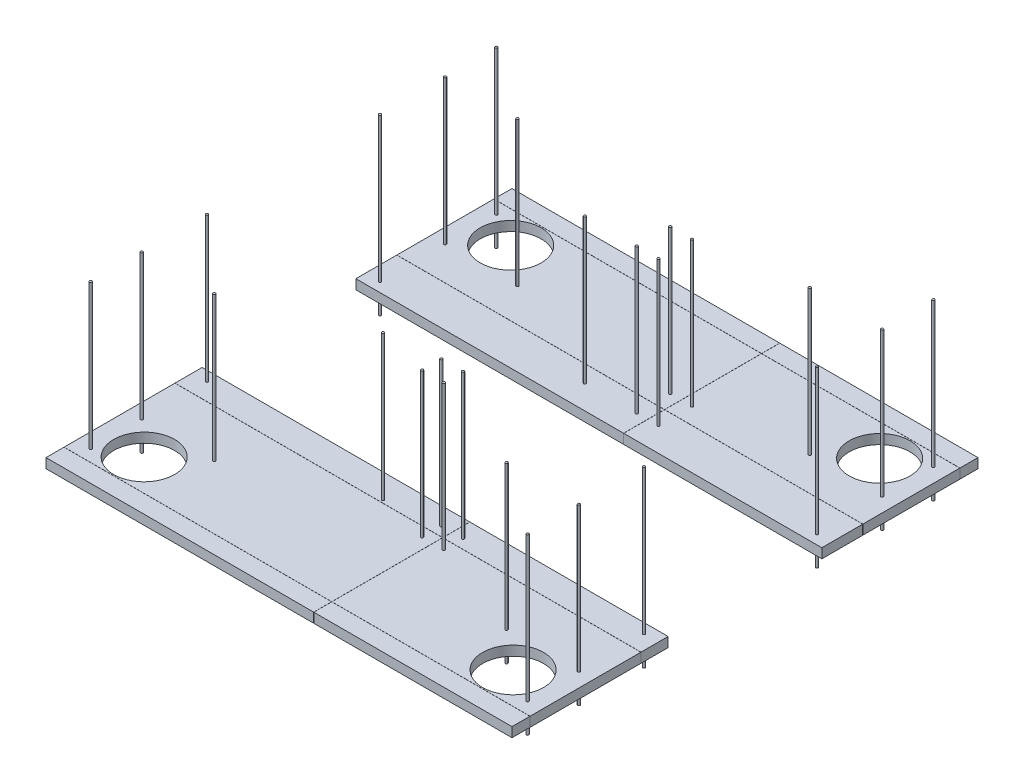
from build123d import *

# Parameters (mm, degrees)
SKETCH1_W                          = 4908.55
SKETCH1_H                          = 4908.55
BOSS_EXTRUDE1_DEPTH                = 101.6
SKETCH2_W                          = 4908.55
SKETCH2_H                          = 1619.25
CUT_EXTRUDE1_DEPTH                 = 3473.355700566
SKETCH4_W                          = 4908.55
SKETCH4_H                          = 1.27
CUT_EXTRUDE_THIN1_DEPTH            = 3473.355700566
CUT_EXTRUDE_THIN2_DEPTH            = 3473.355700566
CUT_EXTRUDE_THIN2_DEPTH_BACK       = 3473.355700566
SKETCH5_W                          = 1.27
SKETCH5_H                          = 4908.55
SKETCH6_R                          = 320.675
DUCT_HOLES_DEPTH                   = 3473.355700566
UNISTRUT_STUD_LAYOUT_DEPTH         = 1524
UNISTRUT_STUD_LAYOUT_DEPTH_BACK    = 304.8
SKETCH7_R                          = 12.7
UNISTRUT_STUD_LAYOUT_2_DEPTH       = 1524
UNISTRUT_STUD_LAYOUT_2_DEPTH_BACK  = 304.8
UNISTRUT_STUD_LAYOUT_3_DEPTH       = 1524
UNISTRUT_STUD_LAYOUT_3_DEPTH_BACK  = 304.8
UNISTRUT_STUD_LAYOUT_4_DEPTH       = 1524
UNISTRUT_STUD_LAYOUT_4_DEPTH_BACK  = 304.8
UNISTRUT_STUD_LAYOUT_5_DEPTH       = 1524
UNISTRUT_STUD_LAYOUT_5_DEPTH_BACK  = 304.8
UNISTRUT_STUD_LAYOUT_6_DEPTH       = 1524
UNISTRUT_STUD_LAYOUT_6_DEPTH_BACK  = 304.8
UNISTRUT_STUD_LAYOUT_7_DEPTH       = 1524
UNISTRUT_STUD_LAYOUT_7_DEPTH_BACK  = 304.8
UNISTRUT_STUD_LAYOUT_8_DEPTH       = 1524
UNISTRUT_STUD_LAYOUT_8_DEPTH_BACK  = 304.8
UNISTRUT_STUD_LAYOUT_9_DEPTH       = 1524
UNISTRUT_STUD_LAYOUT_9_DEPTH_BACK  = 304.8
UNISTRUT_STUD_LAYOUT_10_DEPTH      = 1524
UNISTRUT_STUD_LAYOUT_10_DEPTH_BACK = 304.8
UNISTRUT_STUD_LAYOUT_11_DEPTH      = 1524
UNISTRUT_STUD_LAYOUT_11_DEPTH_BACK = 304.8
UNISTRUT_STUD_LAYOUT_12_DEPTH      = 1524
UNISTRUT_STUD_LAYOUT_12_DEPTH_BACK = 304.8
UNISTRUT_STUD_LAYOUT_13_DEPTH      = 1524
UNISTRUT_STUD_LAYOUT_13_DEPTH_BACK = 304.8
UNISTRUT_STUD_LAYOUT_14_DEPTH      = 1524
UNISTRUT_STUD_LAYOUT_14_DEPTH_BACK = 304.8
UNISTRUT_STUD_LAYOUT_15_DEPTH      = 1524
UNISTRUT_STUD_LAYOUT_15_DEPTH_BACK = 304.8
UNISTRUT_STUD_LAYOUT_16_DEPTH      = 1524
UNISTRUT_STUD_LAYOUT_16_DEPTH_BACK = 304.8
UNISTRUT_STUD_LAYOUT_17_DEPTH      = 1524
UNISTRUT_STUD_LAYOUT_17_DEPTH_BACK = 304.8


with BuildPart() as part:
    # Sketch1 → Boss-Extrude1 (new body)
    with BuildSketch(Plane(origin=(0, 0, 0), x_dir=(1, 0, 0), z_dir=(0, 1, 0))):
        Rectangle(SKETCH1_W, SKETCH1_H)
    extrude(amount=BOSS_EXTRUDE1_DEPTH)

    # Sketch2 → Cut-Extrude1 (cut, through all)
    with BuildSketch(Plane(origin=(0, 101.6, 0), x_dir=(1, 0, 0), z_dir=(0, 1, 0))):
        Rectangle(SKETCH2_W, SKETCH2_H)
    extrude(amount=-CUT_EXTRUDE1_DEPTH, mode=Mode.SUBTRACT)


with BuildPart() as cut_extrude1_piece_1:
    # of the separate pieces the step leaves, piece 1, a body of its own (cut_extrude1_pieces)
    add(part.part.solids().sort_by_distance((-2454.275, 0, -2454.275))[0])


with BuildPart() as cut_extrude1_piece_2:
    # of the separate pieces the step leaves, piece 2, a body of its own (cut_extrude1_pieces)
    add(part.part.solids().sort_by_distance((-2454.275, 0, 2454.275))[0])


with BuildPart() as cut_extrude_thin1_tool:
    # Sketch4 → Cut-Extrude-Thin1 (new, through all)
    with BuildSketch(Plane(origin=(0, 101.6, 0), x_dir=(1, 0, 0), z_dir=(0, 1, 0))):
        with Locations((0, -2264.41)):
            Rectangle(SKETCH4_W, SKETCH4_H)
        with Locations((0, -1096.01)):
            Rectangle(SKETCH4_W, SKETCH4_H)
        with Locations((0, 2263.14)):
            Rectangle(SKETCH4_W, SKETCH4_H)
        with Locations((0, 1240.79)):
            Rectangle(SKETCH4_W, SKETCH4_H)
    extrude(amount=-CUT_EXTRUDE_THIN1_DEPTH)


with BuildPart() as cut_extrude1_piece_1_1:
    add(cut_extrude1_piece_1.part)

    # Cut-Extrude-Thin1: cut by cut_extrude_thin1_tool
    add(cut_extrude_thin1_tool.part, mode=Mode.SUBTRACT)


with BuildPart() as cut_extrude1_piece_2_1:
    add(cut_extrude1_piece_2.part)

    # Cut-Extrude-Thin1: cut by cut_extrude_thin1_tool
    add(cut_extrude_thin1_tool.part, mode=Mode.SUBTRACT)


with BuildPart() as cut_extrude_thin1_piece_1:
    # of the separate pieces the step leaves, piece 1, a body of its own (cut_extrude_thin1_pieces)
    add(cut_extrude1_piece_1_1.part.solids().sort_by_distance((-2454.275, 0, -1241.425))[0])


with BuildPart() as cut_extrude_thin1_piece_2:
    # of the separate pieces the step leaves, piece 2, a body of its own (cut_extrude_thin1_pieces)
    add(cut_extrude1_piece_1_1.part.solids().sort_by_distance((-2454.275, 0, -809.625))[0])


with BuildPart() as cut_extrude_thin1_piece_3:
    # of the separate pieces the step leaves, piece 3, a body of its own (cut_extrude_thin1_pieces)
    add(cut_extrude1_piece_1_1.part.solids().sort_by_distance((-2454.275, 0, -2454.275))[0])


with BuildPart() as cut_extrude_thin1_piece_1_of_cut_extrude:
    # of the separate pieces the step leaves, piece 1, a body of its own (cut_extrude_thin1_pieces_of_cut_extrude1)
    add(cut_extrude1_piece_2_1.part.solids().sort_by_distance((-2454.275, 0, 2263.775))[0])


with BuildPart() as cut_extrude_thin1_piece_2_of_cut_extrude:
    # of the separate pieces the step leaves, piece 2, a body of its own (cut_extrude_thin1_pieces_of_cut_extrude1)
    add(cut_extrude1_piece_2_1.part.solids().sort_by_distance((-2454.275, 0, 1095.375))[0])


with BuildPart() as cut_extrude_thin1_piece_3_of_cut_extrude:
    # of the separate pieces the step leaves, piece 3, a body of its own (cut_extrude_thin1_pieces_of_cut_extrude1)
    add(cut_extrude1_piece_2_1.part.solids().sort_by_distance((-2454.275, 0, 2454.275))[0])


with BuildPart() as cut_extrude_thin2_tool:
    # Sketch5 → Cut-Extrude-Thin2 (new, two sides: drawn at the far end of the back side and taken through both)
    with BuildSketch(Plane(origin=(0, 101.6, 0), x_dir=(1, 0, 0), z_dir=(0, 1, 0)).offset(-CUT_EXTRUDE_THIN2_DEPTH_BACK)):
        with Locations((365.76, 0)):
            Rectangle(SKETCH5_W, SKETCH5_H)
    extrude(amount=CUT_EXTRUDE_THIN2_DEPTH + CUT_EXTRUDE_THIN2_DEPTH_BACK)


with BuildPart() as cut_extrude_thin1_piece_1_1:
    add(cut_extrude_thin1_piece_1.part)

    # Cut-Extrude-Thin2: cut by cut_extrude_thin2_tool
    add(cut_extrude_thin2_tool.part, mode=Mode.SUBTRACT)


with BuildPart() as cut_extrude_thin1_piece_2_1:
    add(cut_extrude_thin1_piece_2.part)

    # Cut-Extrude-Thin2: cut by cut_extrude_thin2_tool
    add(cut_extrude_thin2_tool.part, mode=Mode.SUBTRACT)


with BuildPart() as cut_extrude_thin1_piece_3_1:
    add(cut_extrude_thin1_piece_3.part)

    # Cut-Extrude-Thin2: cut by cut_extrude_thin2_tool
    add(cut_extrude_thin2_tool.part, mode=Mode.SUBTRACT)


with BuildPart() as cut_extrude_thin1_piece_1_of_cut_extrude_1:
    add(cut_extrude_thin1_piece_1_of_cut_extrude.part)

    # Cut-Extrude-Thin2: cut by cut_extrude_thin2_tool
    add(cut_extrude_thin2_tool.part, mode=Mode.SUBTRACT)


with BuildPart() as cut_extrude_thin1_piece_2_of_cut_extrude_1:
    add(cut_extrude_thin1_piece_2_of_cut_extrude.part)

    # Cut-Extrude-Thin2: cut by cut_extrude_thin2_tool
    add(cut_extrude_thin2_tool.part, mode=Mode.SUBTRACT)


with BuildPart() as cut_extrude_thin1_piece_3_of_cut_extrude_1:
    add(cut_extrude_thin1_piece_3_of_cut_extrude.part)

    # Cut-Extrude-Thin2: cut by cut_extrude_thin2_tool
    add(cut_extrude_thin2_tool.part, mode=Mode.SUBTRACT)


with BuildPart() as cut_extrude_thin2_piece_1:
    # of the separate pieces the step leaves, piece 1, a body of its own (cut_extrude_thin2_pieces)
    add(cut_extrude_thin1_piece_1_1.part.solids().sort_by_distance((-2454.275, 0, -1241.425))[0])


with BuildPart() as cut_extrude_thin2_piece_2:
    # of the separate pieces the step leaves, piece 2, a body of its own (cut_extrude_thin2_pieces)
    add(cut_extrude_thin1_piece_1_1.part.solids().sort_by_distance((2454.275, 0, -2262.505))[0])


with BuildPart() as cut_extrude_thin2_piece_1_of_cut_extrude:
    # of the separate pieces the step leaves, piece 1, a body of its own (cut_extrude_thin2_pieces_of_cut_extrude)
    add(cut_extrude_thin1_piece_2_1.part.solids().sort_by_distance((-2454.275, 0, -809.625))[0])


with BuildPart() as cut_extrude_thin2_piece_2_of_cut_extrude:
    # of the separate pieces the step leaves, piece 2, a body of its own (cut_extrude_thin2_pieces_of_cut_extrude)
    add(cut_extrude_thin1_piece_2_1.part.solids().sort_by_distance((2454.275, 0, -1240.155))[0])


with BuildPart() as cut_extrude_thin2_piece_1_of_cut_ext_2:
    # of the separate pieces the step leaves, piece 1, a body of its own (cut_extrude_thin2_pieces_of_cut_extr_2)
    add(cut_extrude_thin1_piece_3_1.part.solids().sort_by_distance((-2454.275, 0, -2454.275))[0])


with BuildPart() as cut_extrude_thin2_piece_2_of_cut_ext_2:
    # of the separate pieces the step leaves, piece 2, a body of its own (cut_extrude_thin2_pieces_of_cut_extr_2)
    add(cut_extrude_thin1_piece_3_1.part.solids().sort_by_distance((366.395, 0, -2454.275))[0])


with BuildPart() as cut_extrude_thin2_piece_1_of_cut_ext_3:
    # of the separate pieces the step leaves, piece 1, a body of its own (cut_extrude_thin2_pieces_of_cut_extr_3)
    add(cut_extrude_thin1_piece_1_of_cut_extrude_1.part.solids().sort_by_distance((-2454.275, 0, 2263.775))[0])


with BuildPart() as cut_extrude_thin2_piece_2_of_cut_ext_3:
    # of the separate pieces the step leaves, piece 2, a body of its own (cut_extrude_thin2_pieces_of_cut_extr_3)
    add(cut_extrude_thin1_piece_1_of_cut_extrude_1.part.solids().sort_by_distance((2454.275, 0, 1096.645))[0])


with BuildPart() as cut_extrude_thin2_piece_1_of_cut_ext_4:
    # of the separate pieces the step leaves, piece 1, a body of its own (cut_extrude_thin2_pieces_of_cut_extr_4)
    add(cut_extrude_thin1_piece_2_of_cut_extrude_1.part.solids().sort_by_distance((-2454.275, 0, 1095.375))[0])


with BuildPart() as cut_extrude_thin2_piece_2_of_cut_ext_4:
    # of the separate pieces the step leaves, piece 2, a body of its own (cut_extrude_thin2_pieces_of_cut_extr_4)
    add(cut_extrude_thin1_piece_2_of_cut_extrude_1.part.solids().sort_by_distance((2454.275, 0, 809.625))[0])


with BuildPart() as cut_extrude_thin2_piece_1_of_cut_ext_5:
    # of the separate pieces the step leaves, piece 1, a body of its own (cut_extrude_thin2_pieces_of_cut_extr_5)
    add(cut_extrude_thin1_piece_3_of_cut_extrude_1.part.solids().sort_by_distance((-2454.275, 0, 2454.275))[0])


with BuildPart() as cut_extrude_thin2_piece_2_of_cut_ext_5:
    # of the separate pieces the step leaves, piece 2, a body of its own (cut_extrude_thin2_pieces_of_cut_extr_5)
    add(cut_extrude_thin1_piece_3_of_cut_extrude_1.part.solids().sort_by_distance((2454.275, 0, 2265.045))[0])


with BuildPart() as duct_holes_tool:
    # Sketch6 → DUCT HOLES (new, through all)
    with BuildSketch(Plane(origin=(0, 101.6, 0), x_dir=(1, 0, 0), z_dir=(0, 1, 0))):
        with Locations((1943.1, 1929.13)):
            Circle(SKETCH6_R)
        with Locations((-1943.1, 1929.13)):
            Circle(SKETCH6_R)
        with Locations((-1943.1, -1931.67)):
            Circle(SKETCH6_R)
        with Locations((1943.1, -1931.67)):
            Circle(SKETCH6_R)
    extrude(amount=-DUCT_HOLES_DEPTH)


with BuildPart() as cut_extrude_thin2_piece_1_1:
    add(cut_extrude_thin2_piece_1.part)

    # DUCT HOLES: cut by duct_holes_tool
    add(duct_holes_tool.part, mode=Mode.SUBTRACT)


with BuildPart() as cut_extrude_thin2_piece_2_1:
    add(cut_extrude_thin2_piece_2.part)

    # DUCT HOLES: cut by duct_holes_tool
    add(duct_holes_tool.part, mode=Mode.SUBTRACT)


with BuildPart() as cut_extrude_thin2_piece_1_of_cut_ext_3_1:
    add(cut_extrude_thin2_piece_1_of_cut_ext_3.part)

    # DUCT HOLES: cut by duct_holes_tool
    add(duct_holes_tool.part, mode=Mode.SUBTRACT)


with BuildPart() as cut_extrude_thin2_piece_2_of_cut_ext_3_1:
    add(cut_extrude_thin2_piece_2_of_cut_ext_3.part)

    # DUCT HOLES: cut by duct_holes_tool
    add(duct_holes_tool.part, mode=Mode.SUBTRACT)


with BuildPart() as body_13:
    # Sketch7 → UNISTRUT STUD LAYOUT (new, two sides: drawn at the far end of the back side and taken through both)
    with BuildSketch(Plane(origin=(0, 101.6, 0), x_dir=(1, 0, 0), z_dir=(0, 1, 0)).offset(-UNISTRUT_STUD_LAYOUT_DEPTH_BACK)):
        with Locations((1539.875, 1597.025)):
            Circle(SKETCH7_R)
    extrude(amount=UNISTRUT_STUD_LAYOUT_DEPTH + UNISTRUT_STUD_LAYOUT_DEPTH_BACK)


with BuildPart() as body_14:
    # Sketch7 → UNISTRUT STUD LAYOUT 2 (new, two sides: drawn at the far end of the back side and taken through both)
    with BuildSketch(Plane(origin=(0, 101.6, 0), x_dir=(1, 0, 0), z_dir=(0, 1, 0)).offset(-UNISTRUT_STUD_LAYOUT_2_DEPTH_BACK)):
        with Locations((-1539.875, 1597.025)):
            Circle(SKETCH7_R)
    extrude(amount=UNISTRUT_STUD_LAYOUT_2_DEPTH + UNISTRUT_STUD_LAYOUT_2_DEPTH_BACK)


with BuildPart() as body_15:
    # Sketch7 → UNISTRUT STUD LAYOUT 3 (new, two sides: drawn at the far end of the back side and taken through both)
    with BuildSketch(Plane(origin=(0, 101.6, 0), x_dir=(1, 0, 0), z_dir=(0, 1, 0)).offset(-UNISTRUT_STUD_LAYOUT_3_DEPTH_BACK)):
        with Locations((479.425, 1063.625)):
            Circle(SKETCH7_R)
    extrude(amount=UNISTRUT_STUD_LAYOUT_3_DEPTH + UNISTRUT_STUD_LAYOUT_3_DEPTH_BACK)


with BuildPart() as body_16:
    # Sketch7 → UNISTRUT STUD LAYOUT 4 (new, two sides: drawn at the far end of the back side and taken through both)
    with BuildSketch(Plane(origin=(0, 101.6, 0), x_dir=(1, 0, 0), z_dir=(0, 1, 0)).offset(-UNISTRUT_STUD_LAYOUT_4_DEPTH_BACK)):
        with Locations((-295.275, 1063.625)):
            Circle(SKETCH7_R)
    extrude(amount=UNISTRUT_STUD_LAYOUT_4_DEPTH + UNISTRUT_STUD_LAYOUT_4_DEPTH_BACK)


with BuildPart() as body_17:
    # Sketch7 → UNISTRUT STUD LAYOUT 5 (new, two sides: drawn at the far end of the back side and taken through both)
    with BuildSketch(Plane(origin=(0, 101.6, 0), x_dir=(1, 0, 0), z_dir=(0, 1, 0)).offset(-UNISTRUT_STUD_LAYOUT_5_DEPTH_BACK)):
        with Locations((-2301.875, 1597.025)):
            Circle(SKETCH7_R)
    extrude(amount=UNISTRUT_STUD_LAYOUT_5_DEPTH + UNISTRUT_STUD_LAYOUT_5_DEPTH_BACK)


with BuildPart() as body_18:
    # Sketch7 → UNISTRUT STUD LAYOUT 6 (new, two sides: drawn at the far end of the back side and taken through both)
    with BuildSketch(Plane(origin=(0, 101.6, 0), x_dir=(1, 0, 0), z_dir=(0, 1, 0)).offset(-UNISTRUT_STUD_LAYOUT_6_DEPTH_BACK)):
        with Locations((2301.875, 1597.025)):
            Circle(SKETCH7_R)
    extrude(amount=UNISTRUT_STUD_LAYOUT_6_DEPTH + UNISTRUT_STUD_LAYOUT_6_DEPTH_BACK)


with BuildPart() as body_19:
    # Sketch7 → UNISTRUT STUD LAYOUT 7 (new, two sides: drawn at the far end of the back side and taken through both)
    with BuildSketch(Plane(origin=(0, 101.6, 0), x_dir=(1, 0, 0), z_dir=(0, 1, 0)).offset(-UNISTRUT_STUD_LAYOUT_7_DEPTH_BACK)):
        with Locations((-2301.875, 2136.775)):
            Circle(SKETCH7_R)
    extrude(amount=UNISTRUT_STUD_LAYOUT_7_DEPTH + UNISTRUT_STUD_LAYOUT_7_DEPTH_BACK)


with BuildPart() as body_20:
    # Sketch7 → UNISTRUT STUD LAYOUT 8 (new, two sides: drawn at the far end of the back side and taken through both)
    with BuildSketch(Plane(origin=(0, 101.6, 0), x_dir=(1, 0, 0), z_dir=(0, 1, 0)).offset(-UNISTRUT_STUD_LAYOUT_8_DEPTH_BACK)):
        with Locations((2301.875, 2136.775)):
            Circle(SKETCH7_R)
    extrude(amount=UNISTRUT_STUD_LAYOUT_8_DEPTH + UNISTRUT_STUD_LAYOUT_8_DEPTH_BACK)


with BuildPart() as body_21:
    # Sketch7 → UNISTRUT STUD LAYOUT 9 (new, two sides: drawn at the far end of the back side and taken through both)
    with BuildSketch(Plane(origin=(0, 101.6, 0), x_dir=(1, 0, 0), z_dir=(0, 1, 0)).offset(-UNISTRUT_STUD_LAYOUT_9_DEPTH_BACK)):
        with Locations((250.825, 1416.685)):
            Circle(SKETCH7_R)
    extrude(amount=UNISTRUT_STUD_LAYOUT_9_DEPTH + UNISTRUT_STUD_LAYOUT_9_DEPTH_BACK)


with BuildPart() as body_22:
    # Sketch7 → UNISTRUT STUD LAYOUT 10 (new, two sides: drawn at the far end of the back side and taken through both)
    with BuildSketch(Plane(origin=(0, 101.6, 0), x_dir=(1, 0, 0), z_dir=(0, 1, 0)).offset(-UNISTRUT_STUD_LAYOUT_10_DEPTH_BACK)):
        with Locations((479.425, 1416.685)):
            Circle(SKETCH7_R)
    extrude(amount=UNISTRUT_STUD_LAYOUT_10_DEPTH + UNISTRUT_STUD_LAYOUT_10_DEPTH_BACK)


with BuildPart() as body_23:
    # Sketch7 → UNISTRUT STUD LAYOUT 11 (new, two sides: drawn at the far end of the back side and taken through both)
    with BuildSketch(Plane(origin=(0, 101.6, 0), x_dir=(1, 0, 0), z_dir=(0, 1, 0)).offset(-UNISTRUT_STUD_LAYOUT_11_DEPTH_BACK)):
        with Locations((250.825, 1063.625)):
            Circle(SKETCH7_R)
    extrude(amount=UNISTRUT_STUD_LAYOUT_11_DEPTH + UNISTRUT_STUD_LAYOUT_11_DEPTH_BACK)


with BuildPart() as body_24:
    # Sketch7 → UNISTRUT STUD LAYOUT 12 (new, two sides: drawn at the far end of the back side and taken through both)
    with BuildSketch(Plane(origin=(0, 101.6, 0), x_dir=(1, 0, 0), z_dir=(0, 1, 0)).offset(-UNISTRUT_STUD_LAYOUT_12_DEPTH_BACK)):
        with Locations((479.425, -995.045)):
            Circle(SKETCH7_R)
    extrude(amount=UNISTRUT_STUD_LAYOUT_12_DEPTH + UNISTRUT_STUD_LAYOUT_12_DEPTH_BACK)


with BuildPart() as body_25:
    # Sketch7 → UNISTRUT STUD LAYOUT 13 (new, two sides: drawn at the far end of the back side and taken through both)
    with BuildSketch(Plane(origin=(0, 101.6, 0), x_dir=(1, 0, 0), z_dir=(0, 1, 0)).offset(-UNISTRUT_STUD_LAYOUT_13_DEPTH_BACK)):
        with Locations((250.825, -995.045)):
            Circle(SKETCH7_R)
    extrude(amount=UNISTRUT_STUD_LAYOUT_13_DEPTH + UNISTRUT_STUD_LAYOUT_13_DEPTH_BACK)


with BuildPart() as body_26:
    # Sketch7 → UNISTRUT STUD LAYOUT 14 (new, two sides: drawn at the far end of the back side and taken through both)
    with BuildSketch(Plane(origin=(0, 101.6, 0), x_dir=(1, 0, 0), z_dir=(0, 1, 0)).offset(-UNISTRUT_STUD_LAYOUT_14_DEPTH_BACK)):
        with Locations((250.825, -1198.245)):
            Circle(SKETCH7_R)
    extrude(amount=UNISTRUT_STUD_LAYOUT_14_DEPTH + UNISTRUT_STUD_LAYOUT_14_DEPTH_BACK)


with BuildPart() as body_27:
    # Sketch7 → UNISTRUT STUD LAYOUT 15 (new, two sides: drawn at the far end of the back side and taken through both)
    with BuildSketch(Plane(origin=(0, 101.6, 0), x_dir=(1, 0, 0), z_dir=(0, 1, 0)).offset(-UNISTRUT_STUD_LAYOUT_15_DEPTH_BACK)):
        with Locations((479.425, -1198.245)):
            Circle(SKETCH7_R)
    extrude(amount=UNISTRUT_STUD_LAYOUT_15_DEPTH + UNISTRUT_STUD_LAYOUT_15_DEPTH_BACK)


with BuildPart() as body_28:
    # Sketch7 → UNISTRUT STUD LAYOUT 16 (new, two sides: drawn at the far end of the back side and taken through both)
    with BuildSketch(Plane(origin=(0, 101.6, 0), x_dir=(1, 0, 0), z_dir=(0, 1, 0)).offset(-UNISTRUT_STUD_LAYOUT_16_DEPTH_BACK)):
        with Locations((-2301.875, 911.225)):
            Circle(SKETCH7_R)
    extrude(amount=UNISTRUT_STUD_LAYOUT_16_DEPTH + UNISTRUT_STUD_LAYOUT_16_DEPTH_BACK)


with BuildPart() as body_29:
    # Sketch7 → UNISTRUT STUD LAYOUT 17 (new, two sides: drawn at the far end of the back side and taken through both)
    with BuildSketch(Plane(origin=(0, 101.6, 0), x_dir=(1, 0, 0), z_dir=(0, 1, 0)).offset(-UNISTRUT_STUD_LAYOUT_17_DEPTH_BACK)):
        with Locations((2301.875, 911.225)):
            Circle(SKETCH7_R)
    extrude(amount=UNISTRUT_STUD_LAYOUT_17_DEPTH + UNISTRUT_STUD_LAYOUT_17_DEPTH_BACK)


with BuildPart() as body_30:
    # Mirror3: mirrored copy
    add(body_17.part.mirror(Plane.XY))


with BuildPart() as body_31:
    # Mirror3 2: mirrored copy
    add(body_14.part.mirror(Plane.XY))


with BuildPart() as body_32:
    # Mirror3 3: mirrored copy
    add(body_16.part.mirror(Plane.XY))


with BuildPart() as body_33:
    # Mirror3 4: mirrored copy
    add(body_13.part.mirror(Plane.XY))


with BuildPart() as body_34:
    # Mirror3 5: mirrored copy
    add(body_18.part.mirror(Plane.XY))


with BuildPart() as body_35:
    # Mirror3 6: mirrored copy
    add(body_19.part.mirror(Plane.XY))


with BuildPart() as body_36:
    # Mirror3 7: mirrored copy
    add(body_20.part.mirror(Plane.XY))


with BuildPart() as body_37:
    # Mirror3 8: mirrored copy
    add(body_29.part.mirror(Plane.XY))


with BuildPart() as body_38:
    # Mirror3 9: mirrored copy
    add(body_28.part.mirror(Plane.XY))


solid = Compound([cut_extrude_thin2_piece_1_of_cut_extrude.part, cut_extrude_thin2_piece_2_of_cut_extrude.part, cut_extrude_thin2_piece_1_of_cut_ext_2.part, cut_extrude_thin2_piece_2_of_cut_ext_2.part, cut_extrude_thin2_piece_1_of_cut_ext_4.part, cut_extrude_thin2_piece_2_of_cut_ext_4.part, cut_extrude_thin2_piece_1_of_cut_ext_5.part, cut_extrude_thin2_piece_2_of_cut_ext_5.part, cut_extrude_thin2_piece_1_1.part, cut_extrude_thin2_piece_2_1.part, cut_extrude_thin2_piece_1_of_cut_ext_3_1.part, cut_extrude_thin2_piece_2_of_cut_ext_3_1.part, body_13.part, body_14.part, body_15.part, body_16.part, body_17.part, body_18.part, body_19.part, body_20.part, body_21.part, body_22.part, body_23.part, body_24.part, body_25.part, body_26.part, body_27.part, body_28.part, body_29.part, body_30.part, body_31.part, body_32.part, body_33.part, body_34.part, body_35.part, body_36.part, body_37.part, body_38.part])
